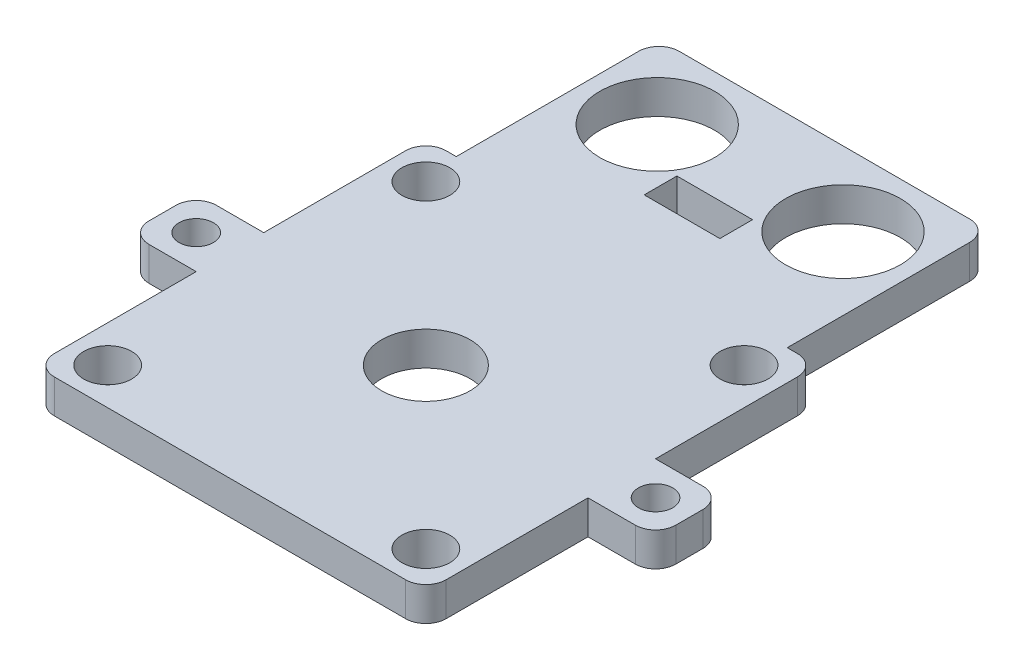
from build123d import *

# Parameters (mm, degrees)
SKETCH1_R           = 21
SKETCH1_R_2         = 20
BOSS_EXTRUDE1_DEPTH = 3.5
SKETCH2_R           = 3.55
SKETCH2_R_2         = 6.55
SKETCH2_R_3         = 2.55
SKETCH2_R_4         = 8.5
SKETCH2_W           = 11.2
SKETCH2_H           = 4.84
BOSS_EXTRUDE2_DEPTH = 5
SKETCH3_W           = 11.2
SKETCH3_H           = 4.84
SKETCH3_W_2         = 49
SKETCH3_H_2         = 8
SKETCH3_R           = 8.5
IGNORE_DEPTH        = 5
SKETCH4_W           = 11.2
SKETCH4_H           = 4.84
SKETCH4_R           = 8.5
CUT_EXTRUDE2_DEPTH  = 71.901339903
FILLET1_R           = 3
SKETCH5_W           = 42
SKETCH5_H           = 3.5
CUT_EXTRUDE3_DEPTH  = 25


with BuildPart() as part:
    # Sketch1 → Boss-Extrude1 (new body)
    with BuildSketch(Plane(origin=(0, 0, 0), x_dir=(1, 0, 0), z_dir=(0, 1, 0))):
        Circle(SKETCH1_R)
        Circle(SKETCH1_R_2, mode=Mode.SUBTRACT)
    extrude(amount=BOSS_EXTRUDE1_DEPTH)

    # Sketch2 → Boss-Extrude2 (add)
    with BuildSketch(Plane(origin=(0, 3.5, 0), x_dir=(1, 0, 0), z_dir=(0, 1, 0))):
        Polygon((-29, -5), (-29, -29), (29, -29), (29, -5), (39, -5), (39, 5), (29, 5), (29, 29), (24.5, 29), (24.5, 51), (-24.5, 51), (-24.5, 29), (-29, 29), (-29, 5), (-39, 5), (-39, -5), align=None)
        with Locations((-23.55, -23.55)):
            Circle(SKETCH2_R, mode=Mode.SUBTRACT)
        with Locations((23.55, -23.55)):
            Circle(SKETCH2_R, mode=Mode.SUBTRACT)
        Circle(SKETCH2_R_2, mode=Mode.SUBTRACT)
        with Locations((-23.55, 23.55)):
            Circle(SKETCH2_R, mode=Mode.SUBTRACT)
        with Locations((23.55, 23.55)):
            Circle(SKETCH2_R, mode=Mode.SUBTRACT)
        with Locations((-34, 0)):
            Circle(SKETCH2_R_3, mode=Mode.SUBTRACT)
        with Locations((13.76, 39)):
            Circle(SKETCH2_R_4, mode=Mode.SUBTRACT)
        with Locations((-13.76, 39)):
            Circle(SKETCH2_R_4, mode=Mode.SUBTRACT)
        with Locations((0, 46.28)):
            Rectangle(SKETCH2_W, SKETCH2_H, mode=Mode.SUBTRACT)
        with Locations((34, 0)):
            Circle(SKETCH2_R_3, mode=Mode.SUBTRACT)
    extrude(amount=BOSS_EXTRUDE2_DEPTH)

    # Sketch3 → Ignore (add)
    with BuildSketch(Plane(origin=(0, 3.5, 0), x_dir=(1, 0, 0), z_dir=(0, 1, 0))):
        with Locations((0, 46.28)):
            Rectangle(SKETCH3_W, SKETCH3_H)
        with Locations((0, 55)):
            Rectangle(SKETCH3_W_2, SKETCH3_H_2)
        with Locations((-13.76, 39)):
            Circle(SKETCH3_R)
        with Locations((13.76, 39)):
            Circle(SKETCH3_R)
    extrude(amount=IGNORE_DEPTH)

    # Sketch4 → Cut-Extrude2 (cut, through all)
    with BuildSketch(Plane(origin=(0, 3.5, 0), x_dir=(1, 0, 0), z_dir=(0, 1, 0))):
        with Locations((-0.079148889, 40.42)):
            Rectangle(SKETCH4_W, SKETCH4_H)
        with Locations((-13.75, 48)):
            Circle(SKETCH4_R)
        with Locations((13.75, 48)):
            Circle(SKETCH4_R)
    extrude(amount=CUT_EXTRUDE2_DEPTH, mode=Mode.SUBTRACT)

    # Fillet1
    fillet1_edges = [part.edges().sort_by_distance(p)[0] for p in [
        (29, 6, -29),
        (39, 6, 5),
        (39, 6, -5),
        (29, 6, 29),
        (-29, 6, 29),
        (-39, 6, 5),
        (-39, 6, -5),
        (-29, 6, -29),
        (24.5, 6, -59),
        (-24.5, 6, -59),
    ]]
    fillet(fillet1_edges, radius=FILLET1_R)

    # Sketch5 → Cut-Extrude3 (cut, symmetric)
    with BuildSketch(Plane.XY):
        with Locations((0, 1.75)):
            Rectangle(SKETCH5_W, SKETCH5_H)
    extrude(amount=CUT_EXTRUDE3_DEPTH, both=True, mode=Mode.SUBTRACT)


solid = part.part
